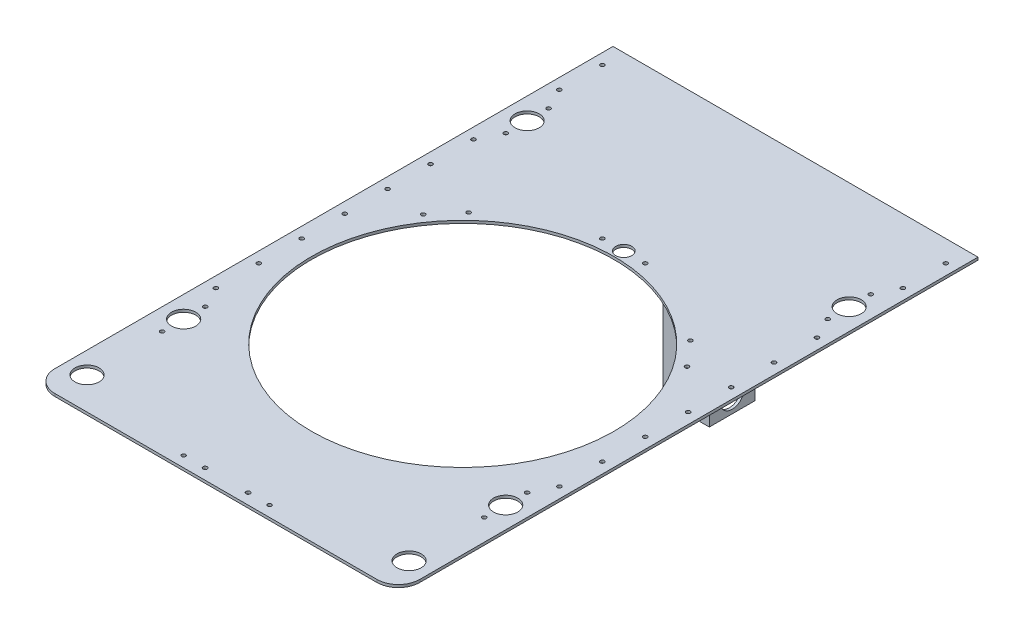
from build123d import *

# Parameters (mm, degrees)
SKETCH1_W           = 431.8
SKETCH1_H           = 685.8
BOSS_EXTRUDE1_DEPTH = 3.175
SKETCH2_R           = 14.3129
SKETCH2_R_2         = 2.38125
CUT_EXTRUDE1_DEPTH  = 406.22006444
SKETCH3_W           = 54.61
SKETCH3_H           = 53.975
BOSS_EXTRUDE2_DEPTH = 203.2
FILLET1_R           = 20.32
SKETCH4_W           = 48.26
SKETCH4_H           = 47.625
CUT_EXTRUDE2_DEPTH  = 203.2
SKETCH5_R           = 14.2875
CUT_EXTRUDE3_DEPTH  = 203.2
SKETCH6_R           = 179.07
CUT_EXTRUDE4_DEPTH  = 455.734934467
SKETCH8_R           = 9.525
SKETCH8_R_2         = 2.38125
CUT_EXTRUDE6_DEPTH  = 455.734934467
FILLET2_R           = 25.4
SKETCH10_R          = 14.3129
SKETCH10_R_2        = 2.38125
CUT_EXTRUDE8_DEPTH  = 455.734934467
SKETCH11_R          = 2.38125
CUT_EXTRUDE9_DEPTH  = 455.734934467
SKETCH13_R          = 2.38125
SKETCH13_R_2        = 2.466421692
SKETCH13_R_3        = 2.307769972
CUT_EXTRUDE10_DEPTH = 455.734934467


with BuildPart() as part:
    # Sketch1 → Boss-Extrude1 (new body)
    with BuildSketch(Plane(origin=(0, 0, 0), x_dir=(1, 0, 0), z_dir=(0, 1, 0))):
        Rectangle(SKETCH1_W, SKETCH1_H)
    extrude(amount=BOSS_EXTRUDE1_DEPTH)

    # Sketch2 → Cut-Extrude1 (cut, through all)
    with BuildSketch(Plane(origin=(0, 3.175, 0), x_dir=(1, 0, 0), z_dir=(0, 1, 0))):
        with Locations((-190.5, -304.8)):
            Circle(SKETCH2_R)
        with Locations((-190.5, -190.5)):
            Circle(SKETCH2_R)
        with Locations((190.5, -304.8)):
            Circle(SKETCH2_R)
        with Locations((190.5, -190.5)):
            Circle(SKETCH2_R)
        with Locations((190.5, -215.9)):
            Circle(SKETCH2_R_2)
        with Locations((190.5, -165.1)):
            Circle(SKETCH2_R_2)
        with Locations((-190.5, -215.9)):
            Circle(SKETCH2_R_2)
        with Locations((-190.5, -165.1)):
            Circle(SKETCH2_R_2)
    extrude(amount=-CUT_EXTRUDE1_DEPTH, mode=Mode.SUBTRACT)

    # Sketch3 → Boss-Extrude2 (add)
    with BuildSketch(Plane(origin=(0, 0, 0), x_dir=(-1, 0, 0), z_dir=(0, -1, 0))):
        with Locations((2.565647285, 243.220856884)):
            Rectangle(SKETCH3_W, SKETCH3_H)
    extrude(amount=BOSS_EXTRUDE2_DEPTH)

    # Fillet1
    fillet1_edges = [part.edges().sort_by_distance(p)[0] for p in [
        (24.739352715, 0, -243.220856884),
        (-2.565647285, 0, -270.208356884),
        (-2.565647285, 0, -216.233356884),
        (-29.870647285, 0, -243.220856884),
    ]]
    fillet(fillet1_edges, radius=FILLET1_R)

    # Sketch4 → Cut-Extrude2 (cut)
    with BuildSketch(Plane(origin=(0, -203.2, 0), x_dir=(-1, 0, 0), z_dir=(0, -1, 0))):
        with Locations((2.565647285, 243.220856884)):
            Rectangle(SKETCH4_W, SKETCH4_H)
    extrude(amount=-CUT_EXTRUDE2_DEPTH, mode=Mode.SUBTRACT)

    # Sketch5 → Cut-Extrude3 (cut)
    with BuildSketch(Plane.ZY.offset(29.870647285)):
        with Locations((-243.220856884, -184.15)):
            Circle(SKETCH5_R)
    extrude(amount=-CUT_EXTRUDE3_DEPTH, mode=Mode.SUBTRACT)

    # Sketch6 → Cut-Extrude4 (cut, through all)
    with BuildSketch(Plane(origin=(0, 3.175, 0), x_dir=(1, 0, 0), z_dir=(0, 1, 0))):
        with Locations((0, -50.8)):
            Circle(SKETCH6_R)
    extrude(amount=-CUT_EXTRUDE4_DEPTH, mode=Mode.SUBTRACT)

    # Sketch8 → Cut-Extrude6 (cut, through all)
    with BuildSketch(Plane(origin=(0, 3.175, 0), x_dir=(1, 0, 0), z_dir=(0, 1, 0))):
        with Locations((0, 139.7)):
            Circle(SKETCH8_R)
        with Locations((25.4, 139.7)):
            Circle(SKETCH8_R_2)
        with Locations((-25.4, 139.7)):
            Circle(SKETCH8_R_2)
    extrude(amount=-CUT_EXTRUDE6_DEPTH, mode=Mode.SUBTRACT)

    # Fillet2
    fillet2_edges = [part.edges().sort_by_distance(p)[0] for p in [
        (215.9, 1.5875, 342.9),
        (-215.9, 1.5875, 342.9),
    ]]
    fillet(fillet2_edges, radius=FILLET2_R)

    # Sketch10 → Cut-Extrude8 (cut, through all)
    with BuildSketch(Plane(origin=(0, 3.175, 0), x_dir=(1, 0, 0), z_dir=(0, 1, 0))):
        with Locations((-190.5, 215.9)):
            Circle(SKETCH10_R)
        with Locations((190.5, 215.9)):
            Circle(SKETCH10_R)
        with Locations((190.5, 190.5)):
            Circle(SKETCH10_R_2)
        with Locations((190.5, 241.3)):
            Circle(SKETCH10_R_2)
        with Locations((-190.5, 190.5)):
            Circle(SKETCH10_R_2)
        with Locations((-190.5, 241.3)):
            Circle(SKETCH10_R_2)
    extrude(amount=-CUT_EXTRUDE8_DEPTH, mode=Mode.SUBTRACT)

    # Sketch11 → Cut-Extrude9 (cut, through all)
    with BuildSketch(Plane(origin=(0, 3.175, 0), x_dir=(1, 0, 0), z_dir=(0, 1, 0))):
        with Locations((156.048464437, 58.466311125)):
            Circle(SKETCH11_R)
        with Locations((131.183773775, 87.334237241)):
            Circle(SKETCH11_R)
        with Locations((-131.183773775, 87.334237241)):
            Circle(SKETCH11_R)
        with Locations((-156.048464437, 58.466311125)):
            Circle(SKETCH11_R)
    extrude(amount=-CUT_EXTRUDE9_DEPTH, mode=Mode.SUBTRACT)

    # Sketch13 → Cut-Extrude10 (cut, through all)
    with BuildSketch(Plane(origin=(0, 3.175, 0), x_dir=(1, 0, 0), z_dir=(0, 1, 0))):
        with Locations((-203.2, 317.5)):
            Circle(SKETCH13_R)
        with Locations((-203.2, 266.7)):
            Circle(SKETCH13_R)
        with Locations((-203.2, 165.1)):
            Circle(SKETCH13_R)
        with Locations((-203.2, 114.3)):
            Circle(SKETCH13_R)
        with Locations((-203.2, 63.5)):
            Circle(SKETCH13_R)
        with Locations((-203.2, 12.7)):
            Circle(SKETCH13_R)
        with Locations((-203.2, -38.1)):
            Circle(SKETCH13_R)
        with Locations((-203.2, -88.9)):
            Circle(SKETCH13_R)
        with Locations((-203.2, -139.7)):
            Circle(SKETCH13_R)
        with Locations((203.2, -139.7)):
            Circle(SKETCH13_R)
        with Locations((203.2, 12.7)):
            Circle(SKETCH13_R)
        with Locations((203.2, 63.5)):
            Circle(SKETCH13_R)
        with Locations((203.2, 114.3)):
            Circle(SKETCH13_R)
        with Locations((203.2, 165.1)):
            Circle(SKETCH13_R)
        with Locations((203.2, 266.7)):
            Circle(SKETCH13_R)
        with Locations((203.2, 317.5)):
            Circle(SKETCH13_R)
        with Locations((-25.4, -330.2)):
            Circle(SKETCH13_R_2)
        with Locations((-50.8, -330.2)):
            Circle(SKETCH13_R_3)
        with Locations((50.8, -330.2)):
            Circle(SKETCH13_R_3)
        with Locations((25.4, -330.2)):
            Circle(SKETCH13_R_2)
        with Locations((203.2, -88.9)):
            Circle(SKETCH13_R)
        with Locations((203.2, -38.1)):
            Circle(SKETCH13_R)
    extrude(amount=-CUT_EXTRUDE10_DEPTH, mode=Mode.SUBTRACT)


solid = part.part
